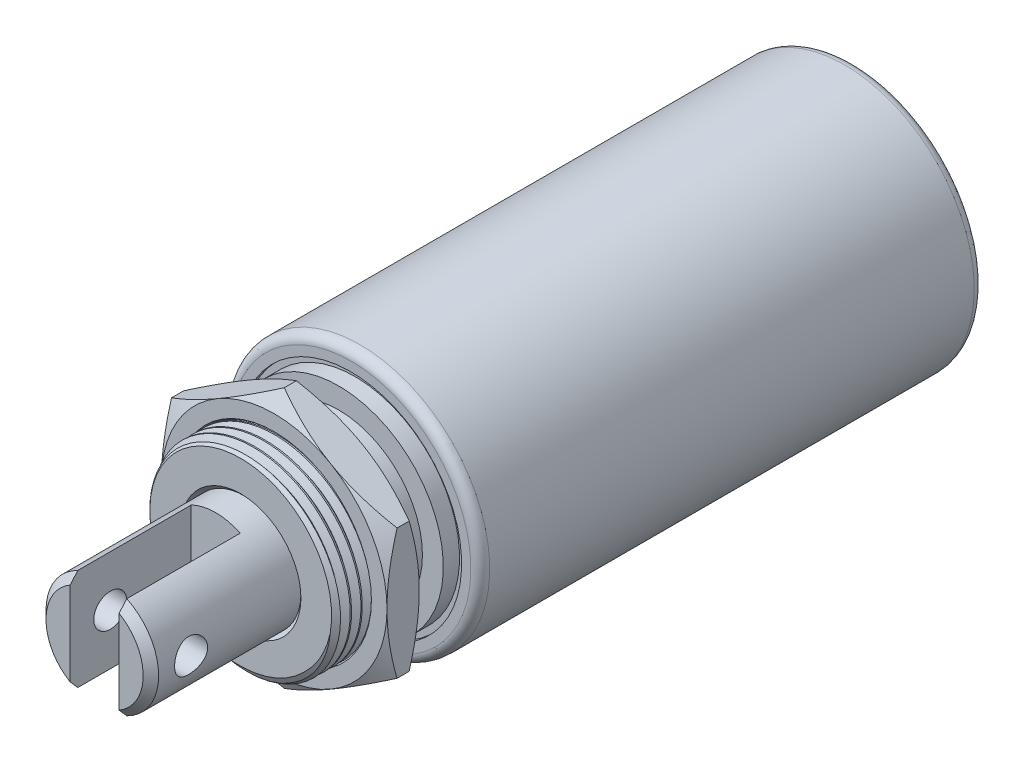
from build123d import *

# Parameters (mm, degrees)
CUT_EXTRUDE1_REACH                  = 56.247
CUT_EXTRUDE1_END_RADIUS             = 5.5499
SKETCH4_W                           = 11.938
SKETCH4_H                           = 4.826
CUT_EXTRUDE1_DIRECTION_2_REACH      = 56.247
CUT_EXTRUDE1_DIRECTION_2_END_RADIUS = 5.5499
CUT_EXTRUDE2_REACH                  = 56.247
CUT_EXTRUDE2_END_RADIUS             = 5.5499
SKETCH5_R                           = 1.6256
CUT_EXTRUDE2_DIRECTION_2_REACH      = 56.247
CUT_EXTRUDE2_DIRECTION_2_END_RADIUS = 5.5499
BOSS_EXTRUDE3_START                 = 3.175
SKETCH10_R                          = 9.46404
BOSS_EXTRUDE3_DEPTH                 = 3.175
CUT_SWEEP1_PITCH                    = 1.058333333


with BuildPart() as part:
    # Sketch1 → Revolve1 (revolve)
    with BuildSketch(Plane(origin=(0, 0, 0), x_dir=(0, 0, -1), z_dir=(1, 0, 0)), mode=Mode.PRIVATE) as revolve1_sk:
        with BuildLine():
            Line((49.8729, 12.7635), (2.1209, 12.7635))
            ThreePointArc((2.1209, 12.7635), (1.465341303, 12.491958697), (1.1938, 11.8364))
            Line((1.1938, 11.8364), (1.1938, 10.922))
            Line((1.1938, 10.922), (1.6002, 10.922))
            Line((1.6002, 10.922), (1.6002, 10.3124))
            Line((1.6002, 10.3124), (0, 10.3124))
            Line((0, 10.3124), (0, 0))
            Line((0, 0), (51.1556, 0))
            Line((51.1556, 0), (51.1556, 2.2225))
            ThreePointArc((51.1556, 2.2225), (51.051447171, 2.473947171), (50.8, 2.5781))
            Line((50.8, 2.5781), (50.8, 11.8364))
            ThreePointArc((50.8, 11.8364), (50.528458697, 12.491958697), (49.8729, 12.7635))
        make_face()
    revolve(revolve1_sk.sketch.rotate(Axis((0, 0, -51.1556), (0, 0, 1)), 90), axis=Axis((0, 0, -51.1556), (0, 0, 1)))

    # Sketch2 → Revolve2 (revolve)
    with BuildSketch(Plane(origin=(0, 0, 0), x_dir=(0, 0, -1), z_dir=(1, 0, 0))):
        Polygon((-9.652, 5.9309), (-9.652, 8.95604), (-9.144, 9.46404), (-2.47904, 9.46404), (-1.27, 8.255), (0, 8.255), (0, 5.5499), (-9.271, 5.5499), align=None)
    revolve(axis=Axis((0, 0, 0), (0, 0, 1)))

    # Cut-Sweep1: the profile of Sketch7 screwed along a right-hand helix of 8.92 turns, 8 arcs to a turn; built about Z, then put on its axis
    cut_sweep1_z = Axis((0, 0, 0), (0, 0, 1))
    cut_sweep1_corners = [(8.776632336, 0, -0.529166667), (8.776632336, 0, -0.396875), (9.521323972, 0, 0.033072917), (9.521323972, 0, -0.959114583)]
    with BuildLine(mode=Mode.PRIVATE) as cut_sweep1_profile:
        Line(cut_sweep1_corners[0], cut_sweep1_corners[1])
        Line(cut_sweep1_corners[1], cut_sweep1_corners[2])
        Line(cut_sweep1_corners[2], cut_sweep1_corners[3])
        Line(cut_sweep1_corners[3], cut_sweep1_corners[0])
    cut_sweep1_cap = Face(cut_sweep1_profile.wire())
    cut_sweep1_turn_angles = [0, 22.5, 45, 67.5, 90, 112.5, 135, 157.5, 180, 202.5, 225, 247.5, 270, 292.5, 315, 337.5, 360]
    cut_sweep1_turn_weights = [1, 0.9238795325112867, 1, 0.9238795325112867, 1, 0.9238795325112867, 1, 0.9238795325112867, 1, 0.9238795325112867, 1, 0.9238795325112867, 1, 0.9238795325112867, 1, 0.9238795325112867, 1]
    cut_sweep1_turn_rails = [Edge.make_bspline([Vector(p[0], p[1], 0).rotate(cut_sweep1_z, cut_sweep1_turn_angles[k]) / cut_sweep1_turn_weights[k] + Vector(0, 0, p[2] + CUT_SWEEP1_PITCH * cut_sweep1_turn_angles[k] / 360) for k in range(17)], [0, 0, 0, 1, 1, 2, 2, 3, 3, 4, 4, 5, 5, 6, 6, 7, 7, 8, 8, 8], 2, cut_sweep1_turn_weights) for p in cut_sweep1_corners]
    cut_sweep1_turn_sides = [Face.make_surface_from_curves(cut_sweep1_turn_rails[p[0]], cut_sweep1_turn_rails[p[1]]) for p in [(0, 1), (1, 2), (2, 3), (3, 0)]]
    cut_sweep1_last_angles = [2880, 2902.5, 2925, 2947.5, 2970, 2992.5, 3015, 3037.5, 3060, 3082.5, 3105, 3127.5, 3150, 3172.5, 3195, 3203.1, 3211.2]
    cut_sweep1_last_weights = [1, 0.9238795325112867, 1, 0.9238795325112867, 1, 0.9238795325112867, 1, 0.9238795325112867, 1, 0.9238795325112867, 1, 0.9238795325112867, 1, 0.9238795325112867, 1, 0.990023657716541, 1]
    cut_sweep1_last_rails = [Edge.make_bspline([Vector(p[0], p[1], 0).rotate(cut_sweep1_z, cut_sweep1_last_angles[k]) / cut_sweep1_last_weights[k] + Vector(0, 0, p[2] + CUT_SWEEP1_PITCH * cut_sweep1_last_angles[k] / 360) for k in range(17)], [0, 0, 0, 1, 1, 2, 2, 3, 3, 4, 4, 5, 5, 6, 6, 7, 7, 8, 8, 8], 2, cut_sweep1_last_weights) for p in cut_sweep1_corners]
    cut_sweep1_last_sides = [Face.make_surface_from_curves(cut_sweep1_last_rails[p[0]], cut_sweep1_last_rails[p[1]]) for p in [(0, 1), (1, 2), (2, 3), (3, 0)]]
    cut_sweep1 = Plane(origin=(0, 0, 9.652), x_dir=(0, 1, 0), z_dir=(0, 0, -1)) * Solid(Shell([*[p.moved(Location((0, 0, CUT_SWEEP1_PITCH * i))) for i in range(8) for p in cut_sweep1_turn_sides], *cut_sweep1_last_sides, cut_sweep1_cap, cut_sweep1_cap.rotate(cut_sweep1_z, 3211.2).moved(Location((0, 0, CUT_SWEEP1_PITCH * 3211.2 / 360)))]))
    add(cut_sweep1, mode=Mode.SUBTRACT)


with BuildPart() as body_2:
    # Sketch3 → Revolve3 (revolve)
    with BuildSketch(Plane(origin=(0, 0, 0), x_dir=(0, 0, -1), z_dir=(1, 0, 0))):
        Polygon((-23.2918, 5.5499), (-24.0538, 4.7879), (-24.0538, 0), (0, 0), (0, 5.5499), align=None)
    revolve(axis=Axis((0, 0, 0), (0, 0, 1)))

    # Cut-Extrude1: up to this cylinder (the profile starts inside it)
    cut_extrude1_end = Plane(origin=(0, 0, 18.0848), z_dir=(0, 0, -1)) * Cylinder(CUT_EXTRUDE1_END_RADIUS, 124.5938, mode=Mode.PRIVATE)
    # Sketch4 → Cut-Extrude1 (cut, up to the surface)
    with BuildSketch(Plane(origin=(0, 0, 0), x_dir=(0, 0, -1), z_dir=(0, 1, 0)), mode=Mode.PRIVATE) as cut_extrude1_sk1:
        with Locations((-18.0848, 0)):
            Rectangle(SKETCH4_W, SKETCH4_H)
    cut_extrude1_tool1 = extrude(cut_extrude1_sk1.sketch, amount=-CUT_EXTRUDE1_REACH, mode=Mode.PRIVATE) & cut_extrude1_end
    add(cut_extrude1_tool1.solids().sort_by_distance((0, 0, 18.0848))[0], mode=Mode.SUBTRACT)

    # Cut-Extrude1 direction 2: up to this cylinder (the profile starts inside it)
    cut_extrude1_direction_2_end = Plane(origin=(0, 0, 18.0848), z_dir=(0, 0, -1)) * Cylinder(CUT_EXTRUDE1_DIRECTION_2_END_RADIUS, 124.5938, mode=Mode.PRIVATE)
    # Sketch4 → Cut-Extrude1 direction 2 (cut, up to the surface)
    with BuildSketch(Plane(origin=(0, 0, 0), x_dir=(0, 0, -1), z_dir=(0, 1, 0)), mode=Mode.PRIVATE) as cut_extrude1_direction_2_sk1:
        with Locations((-18.0848, 0)):
            Rectangle(SKETCH4_W, SKETCH4_H)
    cut_extrude1_direction_2_tool1 = extrude(cut_extrude1_direction_2_sk1.sketch, amount=CUT_EXTRUDE1_DIRECTION_2_REACH, mode=Mode.PRIVATE) & cut_extrude1_direction_2_end
    add(cut_extrude1_direction_2_tool1.solids().sort_by_distance((0, 0, 18.0848))[0], mode=Mode.SUBTRACT)

    # Cut-Extrude2: up to this cylinder (the profile starts inside it)
    cut_extrude2_end = Plane(origin=(0, 0, 20.0914), z_dir=(0, 0, -1)) * Cylinder(CUT_EXTRUDE2_END_RADIUS, 124.5938, mode=Mode.PRIVATE)
    # Sketch5 → Cut-Extrude2 (cut, up to the surface)
    with BuildSketch(Plane(origin=(0, 0, 0), x_dir=(0, -1, 0), z_dir=(1, 0, 0)), mode=Mode.PRIVATE) as cut_extrude2_sk1:
        with Locations(Location((0, -20.0914, 0), (0, 0, 270))):
            Circle(SKETCH5_R)
    cut_extrude2_tool1 = extrude(cut_extrude2_sk1.sketch, amount=CUT_EXTRUDE2_REACH, mode=Mode.PRIVATE) & cut_extrude2_end
    add(cut_extrude2_tool1.solids().sort_by_distance((0, 0, 20.0914))[0], mode=Mode.SUBTRACT)

    # Cut-Extrude2 direction 2: up to this cylinder (the profile starts inside it)
    cut_extrude2_direction_2_end = Plane(origin=(0, 0, 20.0914), z_dir=(0, 0, -1)) * Cylinder(CUT_EXTRUDE2_DIRECTION_2_END_RADIUS, 124.5938, mode=Mode.PRIVATE)
    # Sketch5 → Cut-Extrude2 direction 2 (cut, up to the surface)
    with BuildSketch(Plane(origin=(0, 0, 0), x_dir=(0, -1, 0), z_dir=(1, 0, 0)), mode=Mode.PRIVATE) as cut_extrude2_direction_2_sk1:
        with Locations(Location((0, -20.0914, 0), (0, 0, 270))):
            Circle(SKETCH5_R)
    cut_extrude2_direction_2_tool1 = extrude(cut_extrude2_direction_2_sk1.sketch, amount=-CUT_EXTRUDE2_DIRECTION_2_REACH, mode=Mode.PRIVATE) & cut_extrude2_direction_2_end
    add(cut_extrude2_direction_2_tool1.solids().sort_by_distance((0, 0, 20.0914))[0], mode=Mode.SUBTRACT)


with BuildPart() as body_3:
    # Body-Move/Copy1: copy of body 2
    add(body_2.part.moved(Location((0, 0, 25.4))))


with BuildPart() as body_3_2:
    # Sketch10 → Boss-Extrude3 (new body)
    with BuildSketch(Plane.XY.offset(BOSS_EXTRUDE3_START)):
        Polygon((0, 12.831609733), (-11.1125, 6.415804866), (-11.1125, -6.415804866), (0, -12.831609733), (11.1125, -6.415804866), (11.1125, 6.415804866), align=None)
        Circle(SKETCH10_R, mode=Mode.SUBTRACT)
    extrude(amount=BOSS_EXTRUDE3_DEPTH)

    # Sketch11 → Cut-Revolve1 (revolve, cut)
    with BuildSketch(Plane(origin=(0, 0, 0), x_dir=(0, 0, -1), z_dir=(1, 0, 0)), mode=Mode.PRIVATE) as cut_revolve1_sk:
        Polygon((-6.35, 12.831609733), (-6.35, 11.1125), (-5.357471533, 12.831609733), align=None)
        Polygon((-3.175, 12.831609733), (-3.175, 11.1125), (-4.167528467, 12.831609733), align=None)
        Polygon((-6.35, 9.578607944), (-6.35, 9.46404), (-6.235432056, 9.46404), align=None)
        Polygon((-3.175, 9.578607944), (-3.175, 9.46404), (-3.289567944, 9.46404), align=None)
    revolve(cut_revolve1_sk.sketch.rotate(Axis((0, 0, 6.35), (0, 0, -1)), 90), axis=Axis((0, 0, 6.35), (0, 0, -1)), mode=Mode.SUBTRACT)


solid = Compound([part.part, body_2.part, body_3_2.part])
